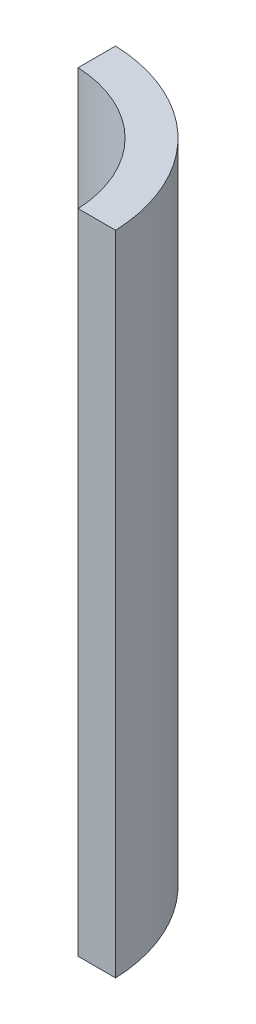
from build123d import *

# Parameters (mm, degrees)
BOSS_EXTRUDE1_DEPTH = 147


with BuildPart() as part:
    # Sketch1 → Boss-Extrude1 (new body)
    with BuildSketch(Plane(origin=(0, 0, 0), x_dir=(1, 0, 0), z_dir=(0, 1, 0))):
        with BuildLine():
            Line((29.211513141, 1.5), (37.720186903, 1.5))
            ThreePointArc((37.720186903, 1.5), (26.69328099, 26.69328099), (1.5, 37.720186903))
            Line((1.5, 37.720186903), (1.5, 29.211513141))
            ThreePointArc((1.5, 29.211513141), (20.68287335, 20.68287335), (29.211513141, 1.5))
        make_face()
    extrude(amount=BOSS_EXTRUDE1_DEPTH)


solid = part.part
